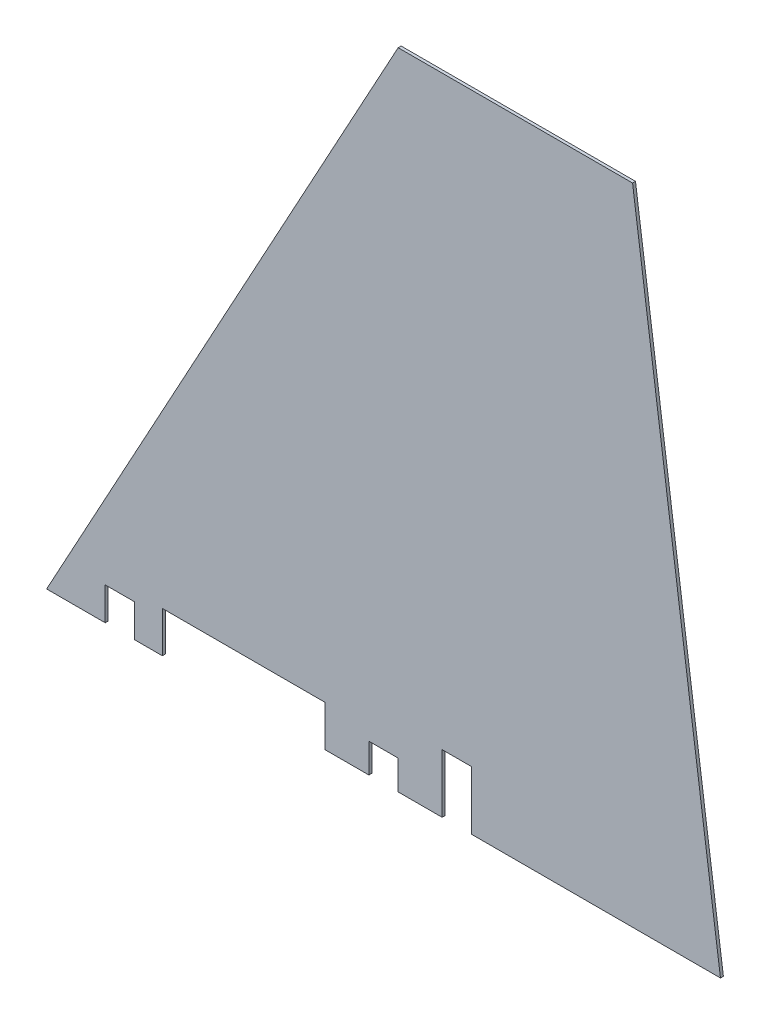
from build123d import *

# Parameters (mm, degrees)
BOSS_EXTRUDE6_DEPTH = 2.54


with BuildPart() as part:
    # Sketch1 → Boss-Extrude6 (new body)
    with BuildSketch(Plane.XY):
        Polygon((357.676037853, 478.945357805), (154.476037853, 478.945357805), (-150.323962147, -79.854642195), (-99.523962147, -79.854642195), (-99.523962147, -51.379153094), (-74.123962147, -51.379153094), (-74.123962147, -79.854642195), (-49.993962147, -79.854642195), (-49.993962147, -44.294642195), (90.976037853, -44.294642195), (90.976037853, -79.854642195), (129.076037853, -79.854642195), (129.076037853, -54.454642195), (154.476037853, -54.454642195), (154.476037853, -79.854642195), (192.576037853, -79.854642195), (192.576037853, -29.054642195), (217.976037853, -29.054642195), (217.976037853, -79.854642195), (433.876037853, -79.854642195), align=None)
    extrude(amount=BOSS_EXTRUDE6_DEPTH)


solid = part.part
